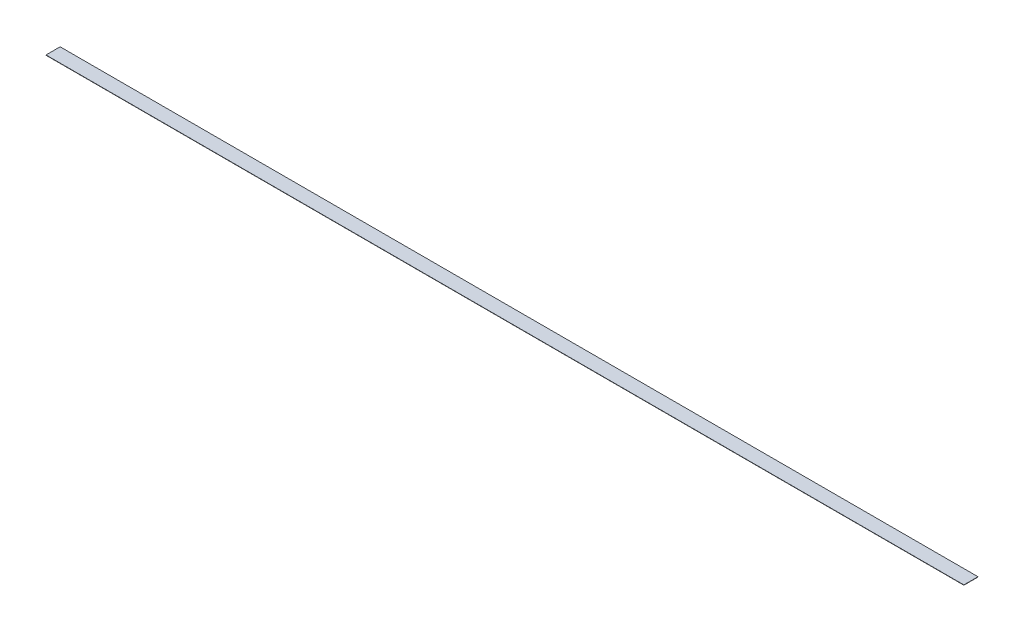
from build123d import *

# Parameters (mm, degrees)
SKETCH1_W           = 206.248
SKETCH1_H           = 0.0635
BOSS_EXTRUDE1_DEPTH = 3.175


with BuildPart() as part:
    # Sketch1 → Boss-Extrude1 (new body)
    with BuildSketch(Plane.XY):
        with Locations((103.1875, 0.03175)):
            Rectangle(SKETCH1_W, SKETCH1_H)
    extrude(amount=BOSS_EXTRUDE1_DEPTH)


solid = part.part
